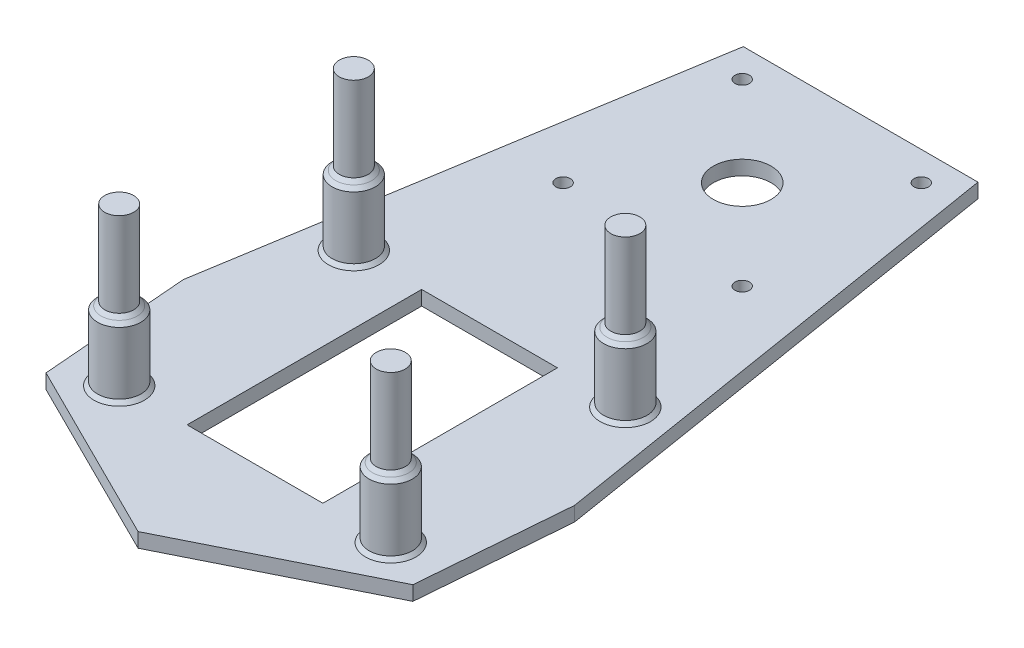
from build123d import *

# Parameters (mm, degrees)
SKETCH1_W           = 82.55
SKETCH1_H           = 127.0659892
SKETCH1_R           = 5.08
SKETCH1_R_2         = 1.27
BASE_EXTRUDE_DEPTH  = 2.54
SKETCH7_R           = 2.55
BOSS_EXTRUDE6_DEPTH = 27.686
SKETCH7_3_R         = 3.81
BOSS_EXTRUDE7_DEPTH = 12.192
CHAMFER1_SIZE       = 0.63
CHAMFER2_SIZE       = 0.63
CHAMFER3_SIZE       = 0.63
CHAMFER4_SIZE       = 0.63
SKETCH8_W           = 23.876
SKETCH8_H           = 41.25
CUT_EXTRUDE1_DEPTH  = 10


with BuildPart() as part:
    # Sketch1 → base extrude (new body)
    with BuildSketch(Plane(origin=(0, 0, 0), x_dir=(1, 0, 0), z_dir=(0, 1, 0))):
        with Locations((41.275, -100.8050054)):
            Rectangle(SKETCH1_W, SKETCH1_H)
        with Locations(Location((41.275, -58.1000108, 0), (0, 0, 270))):
            Circle(SKETCH1_R, mode=Mode.SUBTRACT)
        with Locations(Location((25.527, -42.3520108, 0), (0, 0, 270))):
            Circle(SKETCH1_R_2, mode=Mode.SUBTRACT)
        with Locations(Location((57.023, -42.3520108, 0), (0, 0, 270))):
            Circle(SKETCH1_R_2, mode=Mode.SUBTRACT)
        with Locations(Location((57.023, -73.8480108, 0), (0, 0, 270))):
            Circle(SKETCH1_R_2, mode=Mode.SUBTRACT)
        with Locations(Location((25.527, -73.8480108, 0), (0, 0, 270))):
            Circle(SKETCH1_R_2, mode=Mode.SUBTRACT)
    extrude(amount=BASE_EXTRUDE_DEPTH)

    # Sketch7 → Boss-Extrude6 (add)
    with BuildSketch(Plane(origin=(0, 2.54, 0), x_dir=(1, 0, 0), z_dir=(0, 1, 0))):
        with Locations(Location((65.151, -102.529, 0), (0, 0, 270))):
            Circle(SKETCH7_R)
        with Locations(Location((17.399, -102.529, 0), (0, 0, 270))):
            Circle(SKETCH7_R)
        with Locations(Location((65.151, -143.779, 0), (0, 0, 270))):
            Circle(SKETCH7_R)
        with Locations(Location((17.399, -143.779, 0), (0, 0, 270))):
            Circle(SKETCH7_R)
    extrude(amount=BOSS_EXTRUDE6_DEPTH)

    # Sketch7<3> → Boss-Extrude7 (add)
    with BuildSketch(Plane(origin=(0, 2.54, 0), x_dir=(1, 0, 0), z_dir=(0, 1, 0))):
        with Locations(Location((65.151, -102.529, 0), (0, 0, 90))):
            Circle(SKETCH7_3_R)
        with Locations(Location((17.399, -102.529, 0), (0, 0, 90))):
            Circle(SKETCH7_3_R)
        with Locations(Location((65.151, -143.779, 0), (0, 0, 90))):
            Circle(SKETCH7_3_R)
        with Locations(Location((17.399, -143.779, 0), (0, 0, 90))):
            Circle(SKETCH7_3_R)
    extrude(amount=BOSS_EXTRUDE7_DEPTH)

    # Chamfer1
    chamfer1_edges = [part.edges().sort_by_distance(p)[0] for p in [
        (65.151, 14.732, 99.979),
        (65.151, 2.54, 106.339),
        (65.151, 14.732, 106.339),
    ]]
    chamfer(chamfer1_edges, length=CHAMFER1_SIZE - 0.0001)  # a hair under: the kernel refuses the full size

    # Chamfer2
    chamfer2_edges = [part.edges().sort_by_distance(p)[0] for p in [
        (17.399, 14.732, 99.979),
        (17.399, 2.54, 106.339),
        (17.399, 14.732, 106.339),
    ]]
    chamfer(chamfer2_edges, length=CHAMFER2_SIZE - 0.0001)  # a hair under: the kernel refuses the full size

    # Chamfer3
    chamfer3_edges = [part.edges().sort_by_distance(p)[0] for p in [
        (65.151, 14.732, 141.229),
        (65.151, 2.54, 147.589),
        (65.151, 14.732, 147.589),
    ]]
    chamfer(chamfer3_edges, length=CHAMFER3_SIZE - 0.0001)  # a hair under: the kernel refuses the full size

    # Chamfer4
    chamfer4_edges = [part.edges().sort_by_distance(p)[0] for p in [
        (17.399, 14.732, 141.229),
        (17.399, 2.54, 147.589),
        (17.399, 14.732, 147.589),
    ]]
    chamfer(chamfer4_edges, length=CHAMFER4_SIZE - 0.0001)  # a hair under: the kernel refuses the full size

    # Sketch8 → Cut-Extrude1 (cut)
    with BuildSketch(Plane(origin=(0, 2.54, 0), x_dir=(1, 0, 0), z_dir=(0, 1, 0))):
        Polygon((82.55, -37.2720108), (61.9125, -37.2720108), (75.670833333, -121.982670267), (73.536197868, -148.268757917), (41.275, -164.338), (82.55, -164.338), align=None)
        Polygon((6.879166667, -121.982670267), (20.6375, -37.2720108), (0, -37.2720108), (0, -164.338), (41.275, -164.338), (9.013802132, -148.268757917), align=None)
        with Locations((41.275, -123.154)):
            Rectangle(SKETCH8_W, SKETCH8_H)
    extrude(amount=-CUT_EXTRUDE1_DEPTH, mode=Mode.SUBTRACT)


solid = part.part
